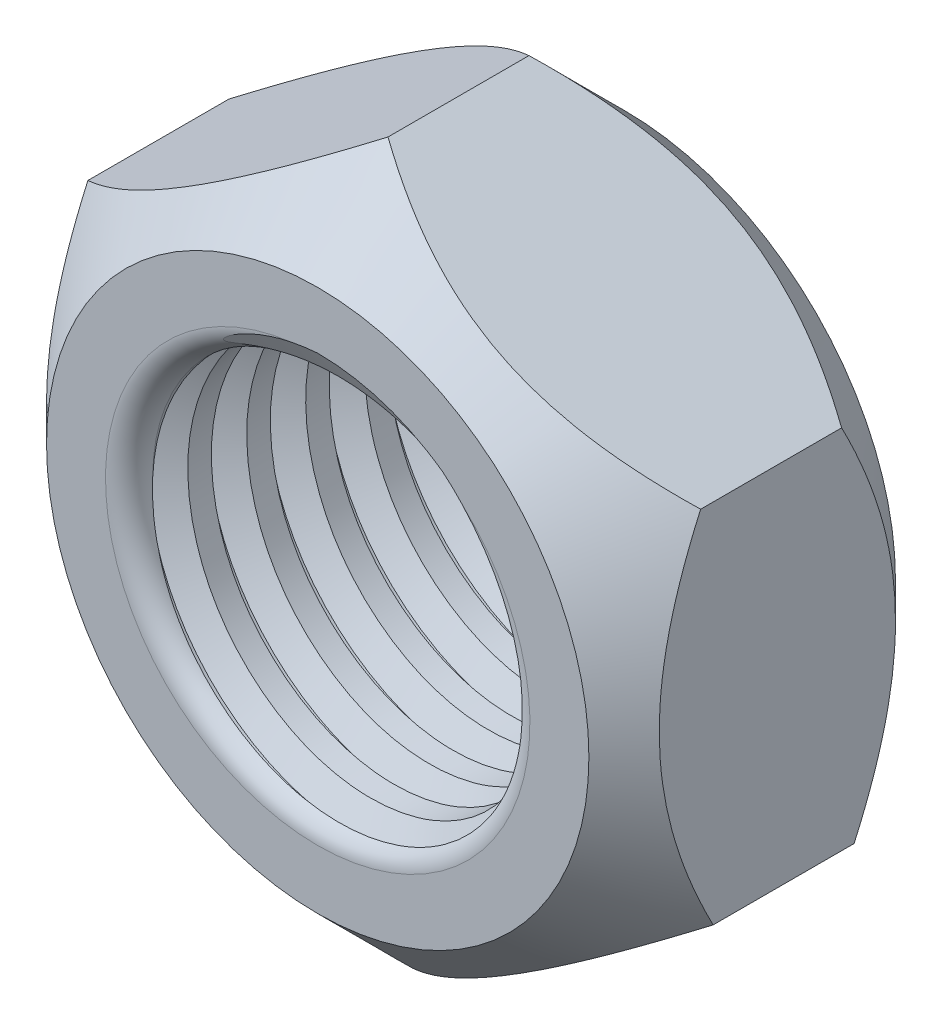
from build123d import *

# Parameters (mm, degrees)
BOSS_EXTRUDE1_DEPTH          = 3.25
SKETCH5_R                    = 4
CUT_EXTRUDE2_DEPTH           = 9
SKETCH6_OUTSIDE_W            = 27.468
SKETCH6_OUTSIDE_H            = 29.212
SKETCH6_OUTSIDE_R            = 5.75
CUT_EXTRUDE3_DEPTH           = 2
CUT_EXTRUDE3_TAPER           = 45
CUT_EXTRUDE3_OTHER_WAY_DEPTH = 2
CUT_EXTRUDE3_OTHER_WAY_DRAFT = -45
MIRROR1_COPY_1_SKETCH_W      = 27.468
MIRROR1_COPY_1_SKETCH_H      = 29.212
MIRROR1_COPY_1_SKETCH_R      = 5.75
MIRROR1_COPY_1_DEPTH         = 2
MIRROR1_COPY_1_DRAFT         = -45
MIRROR1_COPY_2_SKETCH_W      = 27.468
MIRROR1_COPY_2_SKETCH_H      = 29.212
MIRROR1_COPY_2_SKETCH_R      = 5.75
MIRROR1_COPY_2_DEPTH         = 2
MIRROR1_COPY_2_DRAFT         = -45
FILLET1_R                    = 0.5
THREAD3_PITCH                = 1.25


with BuildPart() as part:
    # Sketch1 → Boss-Extrude1 (new, symmetric)
    with BuildSketch(Plane.XY):
        Polygon((6.628526927, -3.520790267), (6.363357276, 3.980077575), (-0.265169651, 7.500867842), (-6.628526927, 3.520790267), (-6.363357276, -3.980077575), (0.265169651, -7.500867842), align=None)
    extrude(amount=BOSS_EXTRUDE1_DEPTH, both=True)

    # Sketch5 → Cut-Extrude2 (cut)
    with BuildSketch(Plane.XY.offset(3.25)):
        Circle(SKETCH5_R)
    extrude(amount=-CUT_EXTRUDE2_DEPTH, mode=Mode.SUBTRACT)

    # Sketch6 outside → Cut-Extrude3 (cut)
    with BuildSketch(Plane.XY.offset(3.25)):
        Rectangle(SKETCH6_OUTSIDE_W, SKETCH6_OUTSIDE_H)
        Circle(SKETCH6_OUTSIDE_R, mode=Mode.SUBTRACT)
    cut_extrude3 = extrude(amount=CUT_EXTRUDE3_DEPTH, taper=CUT_EXTRUDE3_TAPER, mode=Mode.SUBTRACT)


with BuildPart() as cut_extrude3_other_way_tool:
    # Sketch6 outside → Cut-Extrude3 other way (with draft: the straight prism first)
    with BuildSketch(Plane.XY.offset(3.25)):
        Rectangle(SKETCH6_OUTSIDE_W, SKETCH6_OUTSIDE_H)
        Circle(SKETCH6_OUTSIDE_R, mode=Mode.SUBTRACT)
    extrude(amount=-CUT_EXTRUDE3_OTHER_WAY_DEPTH)
    # Cut-Extrude3 other way: the draft: its side faces are tilted about the plane it starts from
    cut_extrude3_other_way_sides = [cut_extrude3_other_way_tool.faces().sort_by_distance(p)[0] for p in [
        (0, -14.606, 2.25),
        (13.734, 0, 2.25),
        (0, 14.606, 2.25),
        (-13.734, 0, 2.25),
        (-5.75, 0, 2.25),
    ]]
    draft(cut_extrude3_other_way_sides, Plane.XY.offset(3.25), CUT_EXTRUDE3_OTHER_WAY_DRAFT)


with BuildPart() as part_1:
    add(part.part)

    # Cut-Extrude3 other way: cut by cut_extrude3_other_way_tool
    add(cut_extrude3_other_way_tool.part, mode=Mode.SUBTRACT)

    # Mirror1: Cut-Extrude3 across plane
    add(cut_extrude3.mirror(Plane.XY), mode=Mode.SUBTRACT)


with BuildPart() as mirror1_copy_1_tool:
    # Mirror1 copy 1 sketch → Mirror1 copy 1 (with draft: the straight prism first)
    with BuildSketch(Plane(origin=(0, 0, -3.25), x_dir=(1, 0, 0), z_dir=(0, 0, -1))):
        Rectangle(MIRROR1_COPY_1_SKETCH_W, MIRROR1_COPY_1_SKETCH_H)
        Circle(MIRROR1_COPY_1_SKETCH_R, mode=Mode.SUBTRACT)
    extrude(amount=-MIRROR1_COPY_1_DEPTH)
    # Mirror1 copy 1: the draft: its side faces are tilted about the plane it starts from
    mirror1_copy_1_sides = [mirror1_copy_1_tool.faces().sort_by_distance(p)[0] for p in [
        (0, -14.606, -2.25),
        (13.734, 0, -2.25),
        (0, 14.606, -2.25),
        (-13.734, 0, -2.25),
        (-5.75, 0, -2.25),
    ]]
    draft(mirror1_copy_1_sides, Plane(origin=(0, 0, -3.25), x_dir=(1, 0, 0), z_dir=(0, 0, -1)), MIRROR1_COPY_1_DRAFT)


with BuildPart() as part_2:
    add(part_1.part)

    # Mirror1 copy 1: cut by mirror1_copy_1_tool
    add(mirror1_copy_1_tool.part, mode=Mode.SUBTRACT)


with BuildPart() as mirror1_copy_2_tool:
    # Mirror1 copy 2 sketch → Mirror1 copy 2 (with draft: the straight prism first)
    with BuildSketch(Plane(origin=(0, 0, -3.25), x_dir=(1, 0, 0), z_dir=(0, 0, -1))):
        Rectangle(MIRROR1_COPY_2_SKETCH_W, MIRROR1_COPY_2_SKETCH_H)
        Circle(MIRROR1_COPY_2_SKETCH_R, mode=Mode.SUBTRACT)
    extrude(amount=-MIRROR1_COPY_2_DEPTH)
    # Mirror1 copy 2: the draft: its side faces are tilted about the plane it starts from
    mirror1_copy_2_sides = [mirror1_copy_2_tool.faces().sort_by_distance(p)[0] for p in [
        (0, -14.606, -2.25),
        (13.734, 0, -2.25),
        (0, 14.606, -2.25),
        (-13.734, 0, -2.25),
        (-5.75, 0, -2.25),
    ]]
    draft(mirror1_copy_2_sides, Plane(origin=(0, 0, -3.25), x_dir=(1, 0, 0), z_dir=(0, 0, -1)), MIRROR1_COPY_2_DRAFT)


with BuildPart() as part_3:
    add(part_2.part)

    # Mirror1 copy 2: cut by mirror1_copy_2_tool
    add(mirror1_copy_2_tool.part, mode=Mode.SUBTRACT)

    # Fillet1
    fillet1_edges = [part_3.edges().sort_by_distance(p)[0] for p in [
        (-4, 0, -3.25),
        (-4, 0, 3.25),
    ]]
    fillet(fillet1_edges, radius=FILLET1_R)

    # Thread3: the profile of Thread Profile4 profile screwed along a right-hand helix of 6.8 turns, 8 arcs to a turn; built about Z, then put on its axis
    thread3_z = Axis((0, 0, 0), (0, 0, 1))
    thread3_corners = [(3.9997, 0, -0.000173205), (4.541265875, 0, 0.312499999), (4.541265875, 0, 0.437499999), (3.9997, 0, 0.750173202)]
    with BuildLine(mode=Mode.PRIVATE) as thread3_profile:
        Line(thread3_corners[0], thread3_corners[1])
        Line(thread3_corners[1], thread3_corners[2])
        Line(thread3_corners[2], thread3_corners[3])
        Line(thread3_corners[3], thread3_corners[0])
    thread3_cap = Face(thread3_profile.wire())
    thread3_turn_angles = [0, 22.5, 45, 67.5, 90, 112.5, 135, 157.5, 180, 202.5, 225, 247.5, 270, 292.5, 315, 337.5, 360]
    thread3_turn_weights = [1, 0.9238795325112867, 1, 0.9238795325112867, 1, 0.9238795325112867, 1, 0.9238795325112867, 1, 0.9238795325112867, 1, 0.9238795325112867, 1, 0.9238795325112867, 1, 0.9238795325112867, 1]
    thread3_turn_rails = [Edge.make_bspline([Vector(p[0], p[1], 0).rotate(thread3_z, thread3_turn_angles[k]) / thread3_turn_weights[k] + Vector(0, 0, p[2] + THREAD3_PITCH * thread3_turn_angles[k] / 360) for k in range(17)], [0, 0, 0, 1, 1, 2, 2, 3, 3, 4, 4, 5, 5, 6, 6, 7, 7, 8, 8, 8], 2, thread3_turn_weights) for p in thread3_corners]
    thread3_turn_sides = [Face.make_surface_from_curves(thread3_turn_rails[p[0]], thread3_turn_rails[p[1]]) for p in [(0, 1), (1, 2), (2, 3), (3, 0)]]
    thread3_last_angles = [2160, 2182.5, 2205, 2227.5, 2250, 2272.5, 2295, 2317.5, 2340, 2362.5, 2385, 2407.5, 2430, 2439, 2448]
    thread3_last_weights = [1, 0.9238795325112867, 1, 0.9238795325112867, 1, 0.9238795325112867, 1, 0.9238795325112867, 1, 0.9238795325112867, 1, 0.9238795325112867, 1, 0.9876883405951383, 1]
    thread3_last_rails = [Edge.make_bspline([Vector(p[0], p[1], 0).rotate(thread3_z, thread3_last_angles[k]) / thread3_last_weights[k] + Vector(0, 0, p[2] + THREAD3_PITCH * thread3_last_angles[k] / 360) for k in range(15)], [0, 0, 0, 1, 1, 2, 2, 3, 3, 4, 4, 5, 5, 6, 6, 7, 7, 7], 2, thread3_last_weights) for p in thread3_corners]
    thread3_last_sides = [Face.make_surface_from_curves(thread3_last_rails[p[0]], thread3_last_rails[p[1]]) for p in [(0, 1), (1, 2), (2, 3), (3, 0)]]
    thread3 = Plane(origin=(0, 0, 5.25), x_dir=(-1, 0, 0), z_dir=(0, 0, -1)) * Solid(Shell([*[p.moved(Location((0, 0, THREAD3_PITCH * i))) for i in range(6) for p in thread3_turn_sides], *thread3_last_sides, thread3_cap, thread3_cap.rotate(thread3_z, 2448).moved(Location((0, 0, THREAD3_PITCH * 2448 / 360)))]))
    add(thread3, mode=Mode.SUBTRACT)


solid = part_3.part
